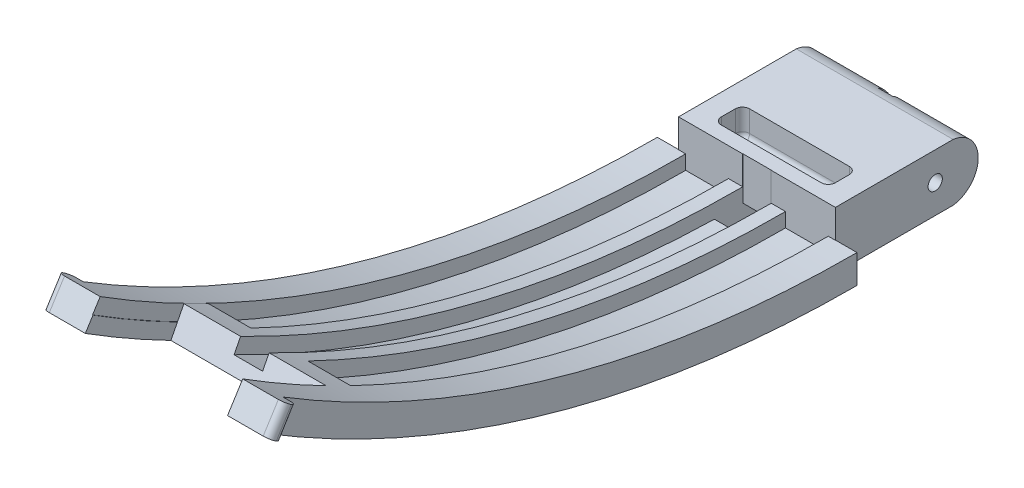
from build123d import *

# Parameters (mm, degrees)
CROQUIS1_W                  = 11
CROQUIS1_H                  = 10
SALIENTE_EXTRUIR1_DEPTH     = 4
CROQUIS2_R                  = 0.5
CORTAR_EXTRUIR1_DEPTH       = 12
CROQUIS3_W                  = 8
CROQUIS3_H                  = 1.977477592
CORTAR_EXTRUIR2_DEPTH       = 2
REDONDEO6_R                 = 0.5
REDONDEO8_R                 = 0.5
CORTAR_EXTRUIR3_DEPTH       = 20
CROQUIS5_W                  = 0.5
CROQUIS5_H                  = 1.744690478
CORTAR_EXTRUIR4_DEPTH       = 1
CORTAR_EXTRUIR6_DEPTH       = 12
CORTAR_EXTRUIR6_DEPTH_BACK  = 5
CROQUIS7_W                  = 1
CROQUIS7_H                  = 0.747728434
CROQUIS7_H_2                = 0.24923361
CROQUIS9_W                  = 2
CROQUIS9_H                  = 2
CORTAR_EXTRUIR7_DEPTH       = 1
REDONDEO10_R                = 0.25
CROQUIS11_W                 = 1.5
CROQUIS11_H                 = 1
CROQUIS11_W_2               = 0.5
CROQUIS11_W_3               = 1
REVOLUCI_N5_ANGLE           = 32.23
REVOLUCI_N5_OTHER_WAY_ANGLE = 0.01
CORTAR_EXTRUIR13_DEPTH      = 7
CORTAR_EXTRUIR13_DEPTH_BACK = 10
CROQUIS13_W                 = 2
CROQUIS13_H                 = 2
CORTAR_REVOLUCI_N1_ANGLE    = 5.013380707
CROQUIS15_W                 = 1
CROQUIS15_H                 = 2
REVOLUCI_N6_ANGLE           = 0.716197243
REDONDEO11_R                = 0.5
CROQUIS16_W                 = 2.973519437
CROQUIS16_H                 = 1
CROQUIS16_W_2               = 3
REVOLUCI_N7_ANGLE           = 1.432394488


with BuildPart() as part:
    # Croquis1 → Saliente-Extruir1 (new body)
    with BuildSketch(Plane(origin=(0, 0, 0), x_dir=(1, 0, 0), z_dir=(0, 1, 0))):
        with Locations((44.686928434, -17.152823879)):
            Rectangle(CROQUIS1_W, CROQUIS1_H)
    extrude(amount=SALIENTE_EXTRUIR1_DEPTH)

    # Croquis2 → Cortar-Extruir1 (cut)
    with BuildSketch(Plane.ZY.offset(-39.186928434)):
        with Locations((15.152823879, 2)):
            Circle(CROQUIS2_R)
    extrude(amount=-CORTAR_EXTRUIR1_DEPTH, mode=Mode.SUBTRACT)

    # Croquis3 → Cortar-Extruir2 (cut)
    with BuildSketch(Plane(origin=(0, 4, 0), x_dir=(1, 0, 0), z_dir=(0, 1, 0))):
        with Locations((44.686928434, -20.164085083)):
            Rectangle(CROQUIS3_W, CROQUIS3_H)
    extrude(amount=-CORTAR_EXTRUIR2_DEPTH, mode=Mode.SUBTRACT)

    # Redondeo6
    redondeo6_edges = [part.edges().sort_by_distance(p)[0] for p in [
        (48.686928434, 3, 19.175346287),
        (48.686928434, 3, 21.152823879),
        (40.686928434, 3, 21.152823879),
        (40.686928434, 3, 19.175346287),
    ]]
    fillet(redondeo6_edges, radius=REDONDEO6_R)

    # Redondeo8
    redondeo8_edges = [part.edges().sort_by_distance(p)[0] for p in [
        (44.686928434, 2, 19.175346287),
        (48.686928434, 2, 20.164085083),
        (40.686928434, 2, 20.164085083),
        (44.686928434, 2, 21.152823879),
        (40.833375043, 2, 19.321792897),
        (40.833375043, 2, 21.00637727),
        (48.540481825, 2, 21.00637727),
        (48.540481825, 2, 19.321792897),
    ]]
    fillet(redondeo8_edges, radius=REDONDEO8_R)

    # Croquis4 → Cortar-Extruir3 (cut)
    with BuildSketch(Plane(origin=(50.186928434, 0, 0), x_dir=(0, 0, -1), z_dir=(1, 0, 0))):
        with BuildLine():
            Line((-12.152823879, 4), (-13.897514357, 4))
            ThreePointArc((-13.897514357, 4), (-12.727134054, 3.425689825), (-12.152823879, 2.255309522))
            Line((-12.152823879, 2.255309522), (-12.152823879, 4))
        make_face()
        with BuildLine():
            ThreePointArc((-12.152823879, 1.744690478), (-12.727134054, 0.574310175), (-13.897514357, 0))
            Line((-13.897514357, 0), (-12.152823879, 0))
            Line((-12.152823879, 0), (-12.152823879, 1.744690478))
        make_face()
    extrude(amount=-CORTAR_EXTRUIR3_DEPTH, mode=Mode.SUBTRACT)

    # Croquis5 → Cortar-Extruir4 (cut)
    with BuildSketch(Plane.XZ):
        Polygon((44.686928434, 13.897514357), (44.686928434, 17.970046761), (44.686928434, 20.152823879), (44.186928434, 20.152823879), (44.186928434, 13.897514357), align=None)
        Polygon((44.686928434, 20.152823879), (44.686928434, 17.970046761), (44.686928434, 13.897514357), (45.186928434, 13.897514357), (45.186928434, 20.152823879), align=None)
        with Locations((44.436928434, 13.025169118)):
            Rectangle(CROQUIS5_W, CROQUIS5_H)
        with Locations((44.936928434, 13.025169118)):
            Rectangle(CROQUIS5_W, CROQUIS5_H)
    extrude(amount=-CORTAR_EXTRUIR4_DEPTH, mode=Mode.SUBTRACT)

    # Croquis7 → Cortar-Extruir6 (cut, two sides: drawn at the far end of the back side and taken through both)
    with BuildSketch(Plane.XZ.offset(-1).offset(-CORTAR_EXTRUIR6_DEPTH_BACK)):
        with Locations((44.686928434, 12.775921706)):
            Rectangle(CROQUIS7_W, CROQUIS7_H)
        with Locations((44.686928434, 12.277440684)):
            Rectangle(CROQUIS7_W, CROQUIS7_H_2)
    extrude(amount=CORTAR_EXTRUIR6_DEPTH + CORTAR_EXTRUIR6_DEPTH_BACK, mode=Mode.SUBTRACT)

    # Croquis9 → Cortar-Extruir7 (cut)
    with BuildSketch(Plane.XZ):
        with Locations((44.686928434, 21.152823879)):
            Rectangle(CROQUIS9_W, CROQUIS9_H)
    extrude(amount=-CORTAR_EXTRUIR7_DEPTH, mode=Mode.SUBTRACT)

    # Redondeo10
    redondeo10_edges = [part.edges().sort_by_distance(p)[0] for p in [
        (45.686928434, 0.5, 20.152823879),
        (43.686928434, 0.5, 20.152823879),
    ]]
    fillet(redondeo10_edges, radius=REDONDEO10_R)

    # Croquis11 → Revolución5 (revolve)
    with BuildSketch(Plane.XY.offset(22.152823879)):
        Polygon((39.186928434, 0), (43.686928434, 0), (43.686928434, 1), (42.686928434, 1), (39.686928434, 1), (39.186928434, 1), align=None)
        with Locations((38.436928434, 0.5)):
            Rectangle(CROQUIS11_W, CROQUIS11_H)
        with Locations((38.436928434, 1.5)):
            Rectangle(CROQUIS11_W, CROQUIS11_H)
        with Locations((39.436928434, 1.5)):
            Rectangle(CROQUIS11_W_2, CROQUIS11_H)
        with Locations((43.186928434, 1.5)):
            Rectangle(CROQUIS11_W_3, CROQUIS11_H)
        with Locations((44.186928434, 0.5)):
            Rectangle(CROQUIS11_W_3, CROQUIS11_H)
        with Locations((45.186928434, 0.5)):
            Rectangle(CROQUIS11_W_3, CROQUIS11_H)
        Polygon((45.686928434, 1), (45.686928434, 0), (50.186928434, 0), (50.186928434, 1), (49.686928434, 1), (46.686928434, 1), align=None)
        with Locations((50.936928434, 1.5)):
            Rectangle(CROQUIS11_W, CROQUIS11_H)
        with Locations((49.936928434, 1.5)):
            Rectangle(CROQUIS11_W_2, CROQUIS11_H)
        with Locations((50.936928434, 0.5)):
            Rectangle(CROQUIS11_W, CROQUIS11_H)
        with Locations((46.186928434, 1.5)):
            Rectangle(CROQUIS11_W_3, CROQUIS11_H)
    revolve(axis=Axis((44.686928434, 79, 22.152823879), (-1, 0, 0)), revolution_arc=REVOLUCI_N5_ANGLE)

    # Croquis11 → Revolución5 other way (revolve)
    with BuildSketch(Plane.XY.offset(22.152823879)):
        Polygon((39.186928434, 0), (43.686928434, 0), (43.686928434, 1), (42.686928434, 1), (39.686928434, 1), (39.186928434, 1), align=None)
        with Locations((38.436928434, 0.5)):
            Rectangle(CROQUIS11_W, CROQUIS11_H)
        with Locations((38.436928434, 1.5)):
            Rectangle(CROQUIS11_W, CROQUIS11_H)
        with Locations((39.436928434, 1.5)):
            Rectangle(CROQUIS11_W_2, CROQUIS11_H)
        with Locations((43.186928434, 1.5)):
            Rectangle(CROQUIS11_W_3, CROQUIS11_H)
        with Locations((44.186928434, 0.5)):
            Rectangle(CROQUIS11_W_3, CROQUIS11_H)
        with Locations((45.186928434, 0.5)):
            Rectangle(CROQUIS11_W_3, CROQUIS11_H)
        Polygon((45.686928434, 1), (45.686928434, 0), (50.186928434, 0), (50.186928434, 1), (49.686928434, 1), (46.686928434, 1), align=None)
        with Locations((50.936928434, 1.5)):
            Rectangle(CROQUIS11_W, CROQUIS11_H)
        with Locations((49.936928434, 1.5)):
            Rectangle(CROQUIS11_W_2, CROQUIS11_H)
        with Locations((50.936928434, 0.5)):
            Rectangle(CROQUIS11_W, CROQUIS11_H)
        with Locations((46.186928434, 1.5)):
            Rectangle(CROQUIS11_W_3, CROQUIS11_H)
    revolve(axis=Axis((44.686928434, 79, 22.152823879), (1, 0, 0)), revolution_arc=REVOLUCI_N5_OTHER_WAY_ANGLE)

    # Croquis13 → Cortar-Extruir13 (cut, two sides: drawn at the far end of the back side and taken through both)
    with BuildSketch(Plane(origin=(0, 1, 0), x_dir=(-1, 0, 0), z_dir=(0, -1, 0)).offset(-CORTAR_EXTRUIR13_DEPTH_BACK)):
        with Locations((-44.686928434, -23.139035778)):
            Rectangle(CROQUIS13_W, CROQUIS13_H)
    extrude(amount=CORTAR_EXTRUIR13_DEPTH + CORTAR_EXTRUIR13_DEPTH_BACK, mode=Mode.SUBTRACT)

    # Croquis14 → Cortar-Revolución1 (revolve, cut)
    with BuildSketch(Plane(origin=(0, 32.464000878, 51.49214672), x_dir=(1, 0, 0), z_dir=(0, 0.5333192687106637, 0.8459140367802884))):
        Polygon((39.713408997, -22.987318925), (39.713408997, -23.987318925), (44.700168716, -23.987318925), (44.700168716, -22.987318925), (43.686928434, -22.987318925), (43.686928434, -21.987318925), (42.686928434, -21.987318925), (42.686928434, -22.987318925), align=None)
        Polygon((44.700168716, -22.987318925), (44.700168716, -23.987318925), (49.686928434, -23.987318925), (49.686928434, -22.987318925), (46.686928434, -22.987318925), (46.686928434, -21.987318925), (45.686928434, -21.987318925), (45.686928434, -22.987318925), align=None)
    revolve(axis=Axis((44.700168716, 79, 22.152823879), (1, 0, 0)), revolution_arc=CORTAR_REVOLUCI_N1_ANGLE, mode=Mode.SUBTRACT)

    # Croquis15 → Revolución6 (revolve)
    with BuildSketch(Plane(origin=(0, 32.464000878, 51.49214672), x_dir=(1, 0, 0), z_dir=(0, 0.5333192687106637, 0.8459140367802884))):
        with Locations((37.186928434, -22.987318925)):
            Rectangle(CROQUIS15_W, CROQUIS15_H)
        with Locations((52.186928434, -22.987318925)):
            Rectangle(CROQUIS15_W, CROQUIS15_H)
    revolve(axis=Axis((39.713408997, 79, 22.152823879), (1, 0, 0)), revolution_arc=REVOLUCI_N6_ANGLE)

    # Redondeo11
    # the kernel refuses this fillet: 0.5 mm, written as the material it takes off along each edge
    with BuildSketch(Plane(origin=(52.686928434, 10.585730005, 64.099816155), x_dir=(0, 0.522703953599643, 0.8525142678520415), z_dir=(0, 0.8525142678520415, -0.5227039535996431)), Plane(origin=(52.686928434, 11.115398548, 64.951695193), x_dir=(-1, 0, 0), z_dir=(0, 0.8459140367802884, -0.5333192687106637)), Plane(origin=(36.686928434, 14.42204421, 61.747648364), x_dir=(0, 0.522703953599643, 0.8525142678520415), z_dir=(0, -0.8525142678520415, 0.5227039535996431)), Plane(origin=(36.686928434, 14.922011714, 62.551758484), x_dir=(1, 0, 0), z_dir=(0, -0.8459140367802884, 0.5333192687106637))) as redondeo11_piece_1:
        with BuildLine():
            CenterArc((REDONDEO11_R, -REDONDEO11_R), REDONDEO11_R, 90, 90)
            Line((0, -REDONDEO11_R), (0, 0))
            Line((0, 0), (REDONDEO11_R, 0))
        make_face()
    extrude(amount=4.5, mode=Mode.SUBTRACT)

    # Croquis16 → Revolución7 (revolve)
    with BuildSketch(Plane(origin=(0, 25.534756625, 49.649833864), x_dir=(1, 0, 0), z_dir=(0, 0.4573558931685637, 0.8892837494208389))):
        with Locations((41.200168715, -17.378308347)):
            Rectangle(CROQUIS16_W, CROQUIS16_H)
        with Locations((48.186928434, -17.378308347)):
            Rectangle(CROQUIS16_W_2, CROQUIS16_H)
    revolve(axis=Axis((44.700168716, 79, 22.152823879), (1, 0, 0)), revolution_arc=REVOLUCI_N7_ANGLE)


solid = part.part
